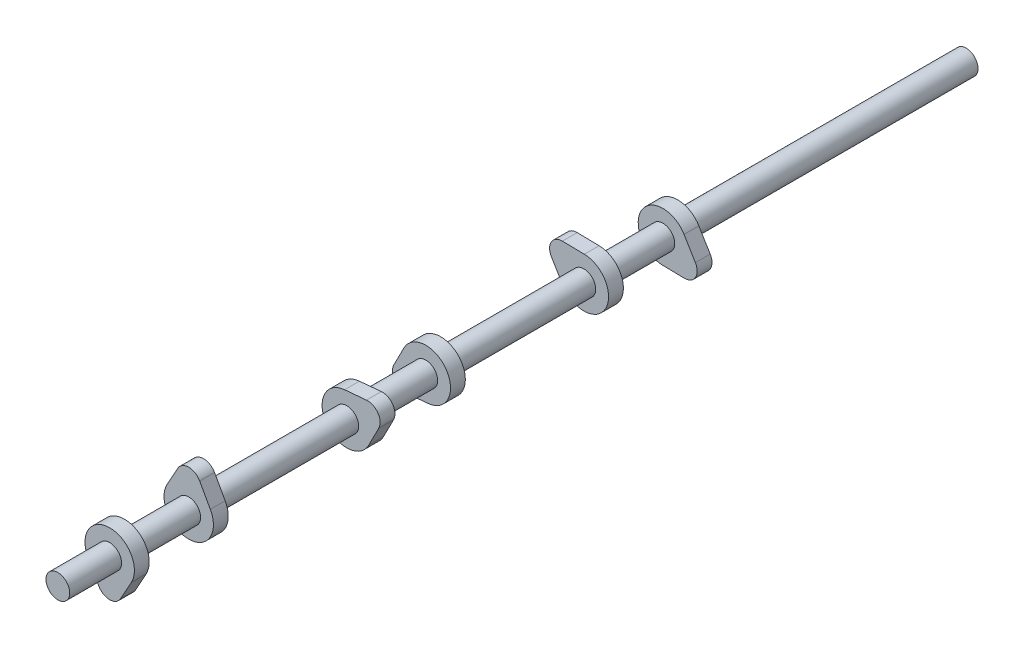
from build123d import *

# Parameters (mm, degrees)
SALIENTE_EXTRUIR1_DEPTH      = 3.75
S_LIDO_MOVER_COPIAR2_ANGLE   = 180
S_LIDO_MOVER_COPIAR4_START   = -243.75
S_LIDO_MOVER_COPIAR4_DEPTH   = 7.5
S_LIDO_MOVER_COPIAR4_START_2 = -203.75
S_LIDO_MOVER_COPIAR4_2_DEPTH = 7.5
S_LIDO_MOVER_COPIAR4_START_3 = -123.75
S_LIDO_MOVER_COPIAR4_3_DEPTH = 7.5
S_LIDO_MOVER_COPIAR4_START_4 = -83.75
S_LIDO_MOVER_COPIAR4_4_DEPTH = 7.5
S_LIDO_MOVER_COPIAR5_ANGLE   = 124
S_LIDO_MOVER_COPIAR6_ANGLE   = 120
CROQUIS5_R                   = 6
SALIENTE_EXTRUIR4_DEPTH      = 275
SALIENTE_EXTRUIR5_START      = 146
CROQUIS6_R                   = 6
SALIENTE_EXTRUIR5_DEPTH      = 146
CROQUIS7_R                   = 6
SALIENTE_EXTRUIR6_DEPTH      = 26.25


# Read off the part's stored shape, not the designer's step: Sólido-Mover/Copiar4
with BuildPart() as part:
    # Croquis1 → Saliente-Extruir1 (new, symmetric)
    with BuildSketch(Plane.XY):
        with BuildLine():
            Line((-5.555796523, 15.775), (-10.936607328, 6.053149606))
            ThreePointArc((-10.936607328, 6.053149606), (0, -12.5), (10.936607328, 6.053149606))
            Line((10.936607328, 6.053149606), (5.555796523, 15.775))
            ThreePointArc((5.555796523, 15.775), (0, 19.05), (-5.555796523, 15.775))
        make_face()
    extrude(amount=SALIENTE_EXTRUIR1_DEPTH, both=True)


with BuildPart() as body_2:
    # Sólido-Mover/Copiar1: copy of part
    add(part.part.moved(Location((0, 0, 40))))


with BuildPart() as body_2_1:
    # Sólido-Mover/Copiar2: moved
    add(body_2.part.rotate(Axis((0, 0, 0), (0, 0, 1)), S_LIDO_MOVER_COPIAR2_ANGLE))


with BuildPart() as body_3:
    # Sólido-Mover/Copiar4 outline → Sólido-Mover/Copiar4 (new body)
    with BuildSketch(Plane.XY.offset(S_LIDO_MOVER_COPIAR4_START)):
        with BuildLine():
            ThreePointArc((5.555796523, 15.775), (0, 19.05), (-5.555796523, 15.775))
            Line((-5.555796523, 15.775), (-10.936607328, 6.053149606))
            ThreePointArc((-10.936607328, 6.053149606), (-12.5, 0), (-10.936607328, -6.053149606))
            ThreePointArc((-10.936607328, -6.053149606), (0, -12.5), (10.936607328, -6.053149606))
            ThreePointArc((10.936607328, -6.053149606), (12.5, 0), (10.936607328, 6.053149606))
            Line((10.936607328, 6.053149606), (5.555796523, 15.775))
        make_face()
    extrude(amount=S_LIDO_MOVER_COPIAR4_DEPTH)


with BuildPart() as body_4:
    # S_lido-Mover_Copiar4 2 outline → S_lido-Mover_Copiar4 2 (new body)
    with BuildSketch(Plane.XY.offset(S_LIDO_MOVER_COPIAR4_START_2)):
        with BuildLine():
            Line((-10.936607328, -6.053149606), (-5.555796523, -15.775))
            ThreePointArc((-5.555796523, -15.775), (0, -19.05), (5.555796523, -15.775))
            Line((5.555796523, -15.775), (10.936607328, -6.053149606))
            ThreePointArc((10.936607328, -6.053149606), (0, 12.5), (-10.936607328, -6.053149606))
        make_face()
    extrude(amount=S_LIDO_MOVER_COPIAR4_2_DEPTH)


with BuildPart() as body_5:
    # S_lido-Mover_Copiar4 3 outline → S_lido-Mover_Copiar4 3 (new body)
    with BuildSketch(Plane.XY.offset(S_LIDO_MOVER_COPIAR4_START_3)):
        with BuildLine():
            ThreePointArc((5.555796523, 15.775), (0, 19.05), (-5.555796523, 15.775))
            Line((-5.555796523, 15.775), (-10.936607328, 6.053149606))
            ThreePointArc((-10.936607328, 6.053149606), (-12.5, 0), (-10.936607328, -6.053149606))
            ThreePointArc((-10.936607328, -6.053149606), (0, -12.5), (10.936607328, -6.053149606))
            ThreePointArc((10.936607328, -6.053149606), (12.5, 0), (10.936607328, 6.053149606))
            Line((10.936607328, 6.053149606), (5.555796523, 15.775))
        make_face()
    extrude(amount=S_LIDO_MOVER_COPIAR4_3_DEPTH)


with BuildPart() as body_6:
    # S_lido-Mover_Copiar4 4 outline → S_lido-Mover_Copiar4 4 (new body)
    with BuildSketch(Plane.XY.offset(S_LIDO_MOVER_COPIAR4_START_4)):
        with BuildLine():
            Line((-10.936607328, -6.053149606), (-5.555796523, -15.775))
            ThreePointArc((-5.555796523, -15.775), (0, -19.05), (5.555796523, -15.775))
            Line((5.555796523, -15.775), (10.936607328, -6.053149606))
            ThreePointArc((10.936607328, -6.053149606), (0, 12.5), (-10.936607328, -6.053149606))
        make_face()
    extrude(amount=S_LIDO_MOVER_COPIAR4_4_DEPTH)


with BuildPart() as body_6_1:
    # Sólido-Mover/Copiar5: moved
    add(body_6.part.rotate(Axis((0, 0, 0), (0, 0, 1)), S_LIDO_MOVER_COPIAR5_ANGLE))


with BuildPart() as body_5_1:
    # Sólido-Mover/Copiar5: moved
    add(body_5.part.rotate(Axis((0, 0, 0), (0, 0, 1)), S_LIDO_MOVER_COPIAR5_ANGLE))


with BuildPart() as body_3_1:
    # Sólido-Mover/Copiar6: moved
    add(body_3.part.rotate(Axis((0, 0, 0), (0, 0, -1)), S_LIDO_MOVER_COPIAR6_ANGLE))


with BuildPart() as body_4_1:
    # Sólido-Mover/Copiar6: moved
    add(body_4.part.rotate(Axis((0, 0, 0), (0, 0, -1)), S_LIDO_MOVER_COPIAR6_ANGLE))


with BuildPart() as part_1:
    add(part.part)

    add(body_2_1.part)  # Saliente-Extruir4 merges body 2

    add(body_3_1.part)  # Saliente-Extruir4 merges body 3

    add(body_4_1.part)  # Saliente-Extruir4 merges body 4

    add(body_5_1.part)  # Saliente-Extruir4 merges body 5

    add(body_6_1.part)  # Saliente-Extruir4 merges body 6
    # Croquis5 → Saliente-Extruir4 (add)
    with BuildSketch(Plane.XY.offset(-236.25)):
        Circle(CROQUIS5_R)
    extrude(amount=SALIENTE_EXTRUIR4_DEPTH)

    # Croquis6 → Saliente-Extruir5 (add)
    with BuildSketch(Plane(origin=(0, 0, -243.75), x_dir=(-1, 0, 0), z_dir=(0, 0, -1)).offset(SALIENTE_EXTRUIR5_START)):
        with Locations(Location((0, 0, 0), (0, 0, 180))):
            Circle(CROQUIS6_R)
    extrude(amount=-SALIENTE_EXTRUIR5_DEPTH)

    # Croquis7 → Saliente-Extruir6 (add)
    with BuildSketch(Plane.XY.offset(43.75)):
        Circle(CROQUIS7_R)
    extrude(amount=SALIENTE_EXTRUIR6_DEPTH)


solid = part_1.part
